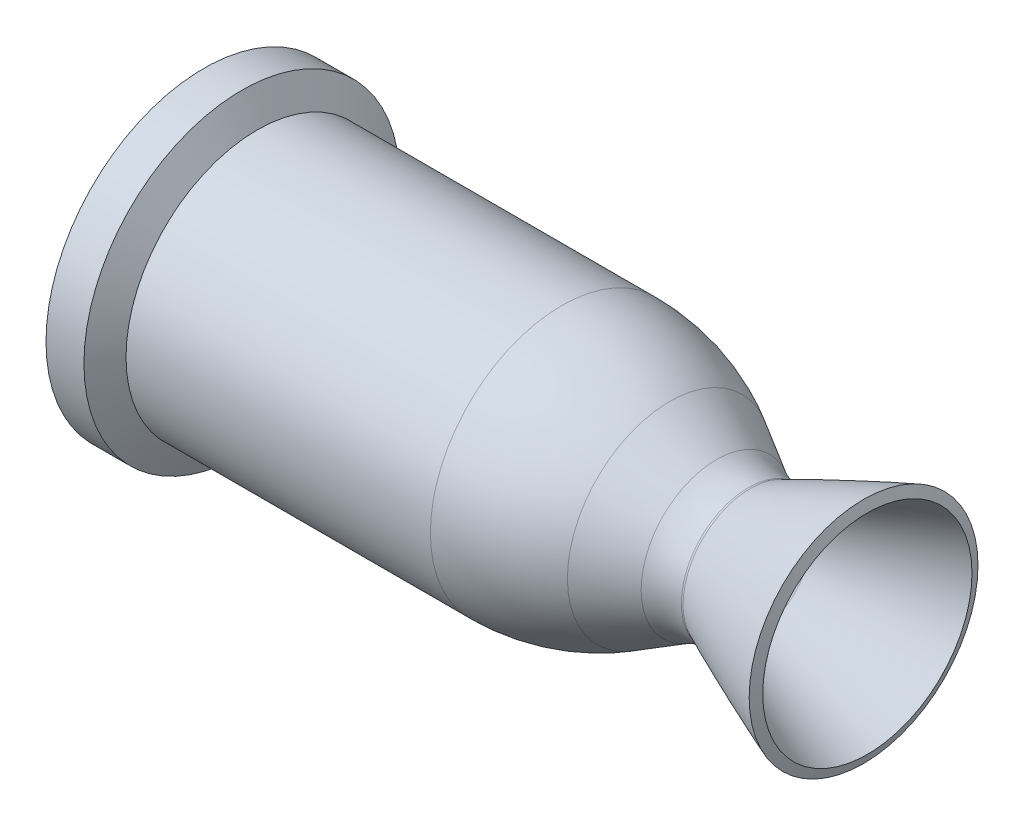
from build123d import *


with BuildPart() as part:
    # Sketch3 → Revolve1 (revolve)
    with BuildSketch(Plane.XY):
        with BuildLine():
            Line((0, 62.50116278), (144.934662069, 62.50116278))
            ThreePointArc((144.934662069, 62.50116278), (171.563195097, 58.995430145), (196.377031865, 48.717179445))
            Line((196.377031865, 48.717179445), (218.627148666, 35.871044168))
            ThreePointArc((218.627148666, 35.871044168), (225.918357505, 32.850926621), (233.742787922, 31.820817416))
            ThreePointArc((233.742787922, 31.820817416), (234.25849688, 31.874994553), (234.751688107, 32.035161047))
            add(Edge.make_bspline(
                [(234.751688107, 32.035161047), (237.01563786, 33.042605222), (241.558012865, 35.047750332), (250.598858454, 38.973761134), (261.865302755, 43.744407277), (273.069848062, 48.325693823), (282.005645487, 51.880791718), (286.451986012, 53.616927894), (288.682041358, 54.479389474)],
                knots=[0, 0, 0, 0, 0.049644807, 0.099289614, 0.198579228, 0.297868842, 0.347513649, 0.397158456, 0.397158456, 0.397158456, 0.397158456], degree=3))
            Line((288.682041358, 54.479389474), (290.485579361, 49.816005438))
            add(Edge.make_bspline(
                [(236.784472704, 27.467044719), (254.870236719, 35.51510214), (272.770570963, 42.964823847), (290.485579361, 49.816005438)],
                knots=[0, 0, 0, 0, 0.397158456, 0.397158456, 0.397158456, 0.397158456], degree=3))
            ThreePointArc((236.784472704, 27.467044719), (235.297572794, 26.98416423), (233.742784709, 26.820827416))
            ThreePointArc((233.742784709, 26.820827416), (224.624261333, 28.021308096), (216.127150111, 31.540927862))
            Line((216.127150111, 31.540927862), (193.87703331, 44.387063139))
            ThreePointArc((193.87703331, 44.387063139), (170.269100478, 54.165811204), (144.934662069, 57.50117278))
            Line((144.934662069, 57.50117278), (0, 57.50117278))
            Line((0, 57.50117278), (0, 62.50116278))
        make_face()
    revolve(axis=Axis((0, 0, 0), (1, 0, 0)))

    # Sketch4 → Revolve5 (revolve)
    with BuildSketch(Plane.XY):
        Polygon((-25.4, 57.50117278), (-25.4, 75.20116278), (-7.332348419, 75.20116278), (0, 62.50116278), (0, 57.50117278), align=None)
    revolve(axis=Axis((0, 0, 0), (1, 0, 0)))


solid = part.part
